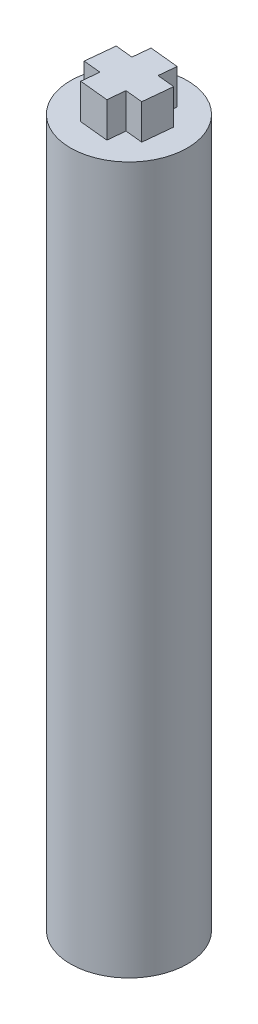
from build123d import *

# Parameters (mm, degrees)
SKETCH_1_R          = 5
EXTRUDE_1_DEPTH     = 2
EXTRUDE_2_DEPTH     = 3.5
EXTRUDE_3_DEPTH     = 3.5
SKETCH_4_R          = 5
EXTRUDE_4_DEPTH     = 0.5
CUT_EXTRUDE_2_DEPTH = 3
CUT_EXTRUDE_3_DEPTH = 2
EXTRUDE_5_DEPTH     = 58
SKETCH_8_R          = 5
EXTRUDE_6_DEPTH     = 58
CUT_EXTRUDE_4_DEPTH = 8
SKETCH_10_R         = 1.5
CUT_EXTRUDE_5_DEPTH = 15
SKETCH_11_R         = 3.5
CUT_EXTRUDE_6_DEPTH = 30
SKETCH_12_R         = 1
CUT_EXTRUDE_7_DEPTH = 7
SKETCH_13_R         = 3.5
SKETCH_14_R         = 1


# Read off the part's stored shape, not the designer's step: 切除-扫描1
with BuildPart() as part:
    # 草图1 → 凸台-拉伸1 (new body)
    with BuildSketch(Plane(origin=(0, 0, 0), x_dir=(1, 0, 0), z_dir=(0, 1, 0))):
        with Locations(Location((0, 0, 0), (0, 0, 270))):
            Circle(SKETCH_1_R)
        Polygon((2.55392077, -1.838021228), (2.868733461, 1.292749652), (0.314812691, 3.13077088), (-2.55392077, 1.838021228), (-2.868733461, -1.292749652), (-0.314812691, -3.13077088), align=None, mode=Mode.SUBTRACT)
    extrude(amount=EXTRUDE_1_DEPTH)

    # 草图2 → 凸台-拉伸2 (add)
    with BuildSketch(Plane(origin=(0, 2, 0), x_dir=(1, 0, 0), z_dir=(0, 1, 0))):
        Polygon((-2.834872538, 1.792623133), (3.135022029, 1.192324151), (2.834872538, -1.792623133), (-3.135022029, -1.192324151), align=None)
    extrude(amount=EXTRUDE_2_DEPTH)

    # 草图3 → 凸台-拉伸3 (add)
    with BuildSketch(Plane(origin=(0, 2, 0), x_dir=(1, 0, 0), z_dir=(0, 1, 0))):
        Polygon((-1.192324151, 3.135022029), (-1.792623133, -2.834872538), (1.192324151, -3.135022029), (1.792623133, 2.834872538), align=None)
    extrude(amount=EXTRUDE_3_DEPTH)

    # 草图4 → 凸台-拉伸4 (add)
    with BuildSketch(Plane(origin=(0, 2, 0), x_dir=(1, 0, 0), z_dir=(0, 1, 0))):
        with Locations(Location((0, 0, 0), (0, 0, 270))):
            Circle(SKETCH_4_R)
    extrude(amount=EXTRUDE_4_DEPTH)

    # 草图5 → 切除-拉伸2 (cut)
    with BuildSketch(Plane(origin=(0, 5.5, 0), x_dir=(1, 0, 0), z_dir=(0, 1, 0))):
        Polygon((-3.135022029, -1.192324151), (-2.834872538, 1.792623133), (-1.342398896, 1.642548387), (-1.192324151, 3.135022029), (1.792623133, 2.834872538), (1.642548387, 1.342398896), (3.135022029, 1.192324151), (2.834872538, -1.792623133), (1.342398896, -1.642548387), (1.192324151, -3.135022029), (-1.792623133, -2.834872538), (-1.642548387, -1.342398896), align=None)
        Polygon((-1.093653289, 1.617535929), (-0.968591001, 2.861263964), (1.518865068, 2.611139388), (1.39380278, 1.367411354), (1.368790323, 1.118665747), (1.617535929, 1.093653289), (2.861263964, 0.968591001), (2.611139388, -1.518865068), (1.367411354, -1.39380278), (1.118665747, -1.368790323), (1.093653289, -1.617535929), (0.968591001, -2.861263964), (-1.518865068, -2.611139388), (-1.39380278, -1.367411354), (-1.368790323, -1.118665747), (-1.617535929, -1.093653289), (-2.861263964, -0.968591001), (-2.611139388, 1.518865068), (-1.367411354, 1.39380278), (-1.118665747, 1.368790323), align=None, mode=Mode.SUBTRACT)
    extrude(amount=-CUT_EXTRUDE_2_DEPTH, mode=Mode.SUBTRACT)

    # 草图6 → 切除-拉伸3 (cut)
    with BuildSketch(Plane.XZ):
        Polygon((2.888759724, -1.318484202), (2.586220675, 1.842497205), (-0.302539048, 3.160981407), (-2.888759724, 1.318484202), (-2.586220675, -1.842497205), (0.302539048, -3.160981407), align=None)
    extrude(amount=-CUT_EXTRUDE_3_DEPTH, mode=Mode.SUBTRACT)

    # 草图7 → 凸台-拉伸5 (add)
    with BuildSketch(Plane(origin=(0, 5.5, 0), x_dir=(1, 0, 0), z_dir=(0, 1, 0))):
        Polygon((-1.118665747, 1.368790323), (-0.968591001, 2.861263964), (1.518865068, 2.611139388), (1.368790323, 1.118665747), (2.861263964, 0.968591001), (2.611139388, -1.518865068), (1.118665747, -1.368790323), (0.968591001, -2.861263964), (-1.518865068, -2.611139388), (-1.368790323, -1.118665747), (-2.861263964, -0.968591001), (-2.611139388, 1.518865068), align=None)
    extrude(amount=EXTRUDE_5_DEPTH)

    # 草图8 → 凸台-拉伸6 (add)
    with BuildSketch(Plane(origin=(0, 2.5, 0), x_dir=(1, 0, 0), z_dir=(0, 1, 0))):
        with Locations(Location((0, 0, 0), (0, 0, 270))):
            Circle(SKETCH_8_R)
    extrude(amount=EXTRUDE_6_DEPTH)

    # 草图9 → 切除-拉伸4 (cut)
    with BuildSketch(Plane.XZ):
        Polygon((2.888759724, -1.318484202), (2.586220675, 1.842497205), (-0.302539048, 3.160981407), (-2.888759724, 1.318484202), (-2.586220675, -1.842497205), (0.302539048, -3.160981407), align=None)
    extrude(amount=-CUT_EXTRUDE_4_DEPTH, mode=Mode.SUBTRACT)

    # 草图10 → 切除-拉伸5 (cut)
    with BuildSketch(Plane.XZ.offset(-8)):
        with Locations(Location((0, 0, 0), (0, 0, 270))):
            Circle(SKETCH_10_R)
    extrude(amount=-CUT_EXTRUDE_5_DEPTH, mode=Mode.SUBTRACT)

    # 草图11 → 切除-拉伸6 (cut)
    with BuildSketch(Plane.XZ.offset(-23)):
        with Locations(Location((0, 0, 0), (0, 0, 270))):
            Circle(SKETCH_11_R)
    extrude(amount=-CUT_EXTRUDE_6_DEPTH, mode=Mode.SUBTRACT)

    # 草图12 → 切除-拉伸7 (cut)
    with BuildSketch(Plane.XZ.offset(-53)):
        with Locations(Location((0, 0, 0), (0, 0, 270))):
            Circle(SKETCH_12_R)
    extrude(amount=-CUT_EXTRUDE_7_DEPTH, mode=Mode.SUBTRACT)

    # 草图13 → 放样1 section 0
    with BuildSketch(Plane.XZ.offset(-53)):
        Circle(SKETCH_13_R)
    # 草图14 → 放样1 section 1
    with BuildSketch(Plane.XZ.offset(-60)):
        Circle(SKETCH_14_R)
    loft()

    # 切除-扫描1 outline → 切除-扫描1 (revolve, cut)
    with BuildSketch(Plane.XY):
        Polygon((3.5, 53), (0, 60.5), (0, 53), align=None)
    revolve(axis=Axis((0, 0, 0), (0, 1, 0)), mode=Mode.SUBTRACT)


solid = part.part
